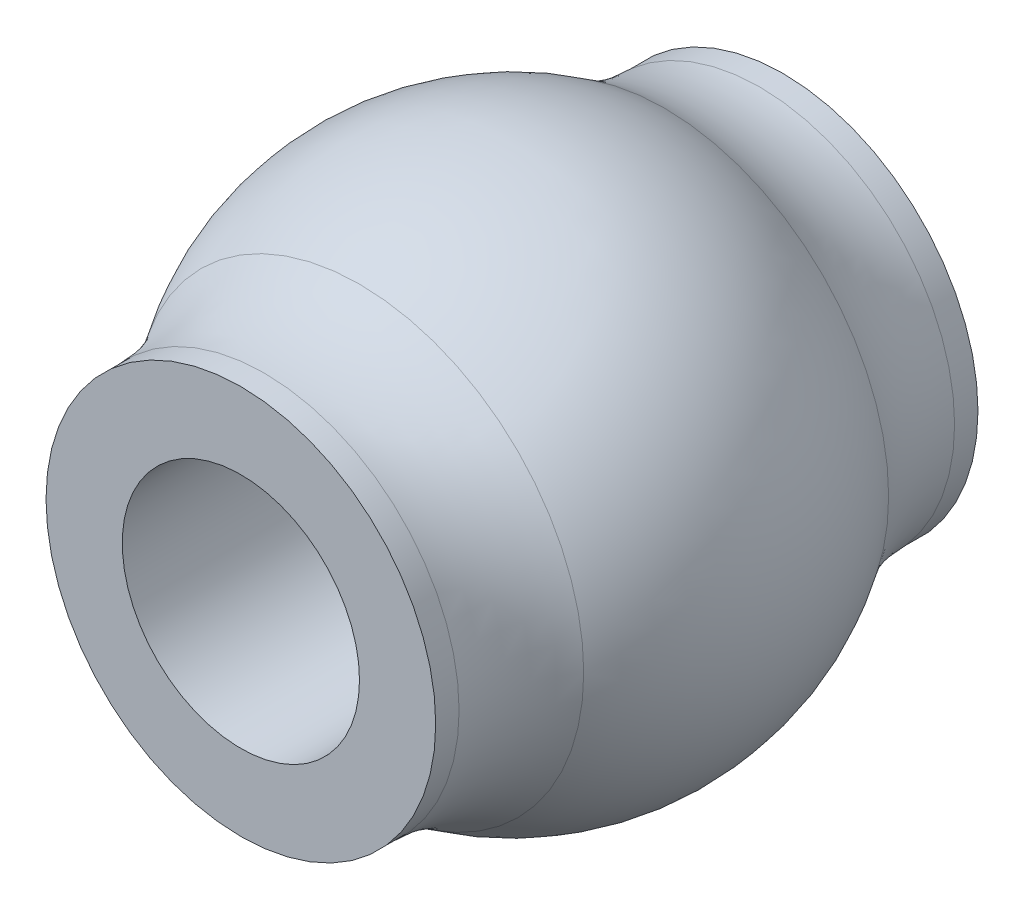
from build123d import *

# Parameters (mm, degrees)
SKETCH2_R           = 2.875
BOSS_EXTRUDE1_DEPTH = 1.218925567
BOSS_EXTRUDE2_START = 1.218925567
SKETCH3_R           = 2.875
BOSS_EXTRUDE2_DEPTH = 1.218925567
SKETCH4_R           = 1.75
CUT_EXTRUDE1_DEPTH  = 14.416407865
FILLET1_R           = 2.5


with BuildPart() as part:
    # Sketch1 → Revolve1 (revolve)
    with BuildSketch(Plane(origin=(0, 0, 0), x_dir=(1, 0, 0), z_dir=(0, 1, 0))):
        with BuildLine():
            Line((8.875, 0.281074433), (6, 0.281074433))
            Line((6, 0.281074433), (6, -5.281074433))
            Line((6, -5.281074433), (8.875, -5.281074433))
            ThreePointArc((8.875, -5.281074433), (10, -2.5), (8.875, 0.281074433))
        make_face()
    revolve(axis=Axis((6, 0, -0.281074433), (0, 0, 1)))

    # Sketch2 → Boss-Extrude1 (add)
    with BuildSketch(Plane(origin=(0, 0, -0.281074433), x_dir=(-1, 0, 0), z_dir=(0, 0, -1))):
        with Locations((-6, 0)):
            Circle(SKETCH2_R)
    extrude(amount=BOSS_EXTRUDE1_DEPTH)

    # Sketch3 → Boss-Extrude2 (add)
    with BuildSketch(Plane.XY.offset(5.281074433).offset(BOSS_EXTRUDE2_START)):
        with Locations((6, 0)):
            Circle(SKETCH3_R)
    extrude(amount=-BOSS_EXTRUDE2_DEPTH)

    # Sketch4 → Cut-Extrude1 (cut, through all)
    with BuildSketch(Plane(origin=(0, 0, -1.5), x_dir=(-1, 0, 0), z_dir=(0, 0, -1))):
        with Locations((-6, 0)):
            Circle(SKETCH4_R)
    extrude(amount=-CUT_EXTRUDE1_DEPTH, mode=Mode.SUBTRACT)

    # Fillet1
    fillet1_edges = [part.edges().sort_by_distance(p)[0] for p in [
        (3.125, 0, 5.281074433),
        (6, 2.875, -0.281074433),
    ]]
    fillet(fillet1_edges, radius=FILLET1_R)


solid = part.part
